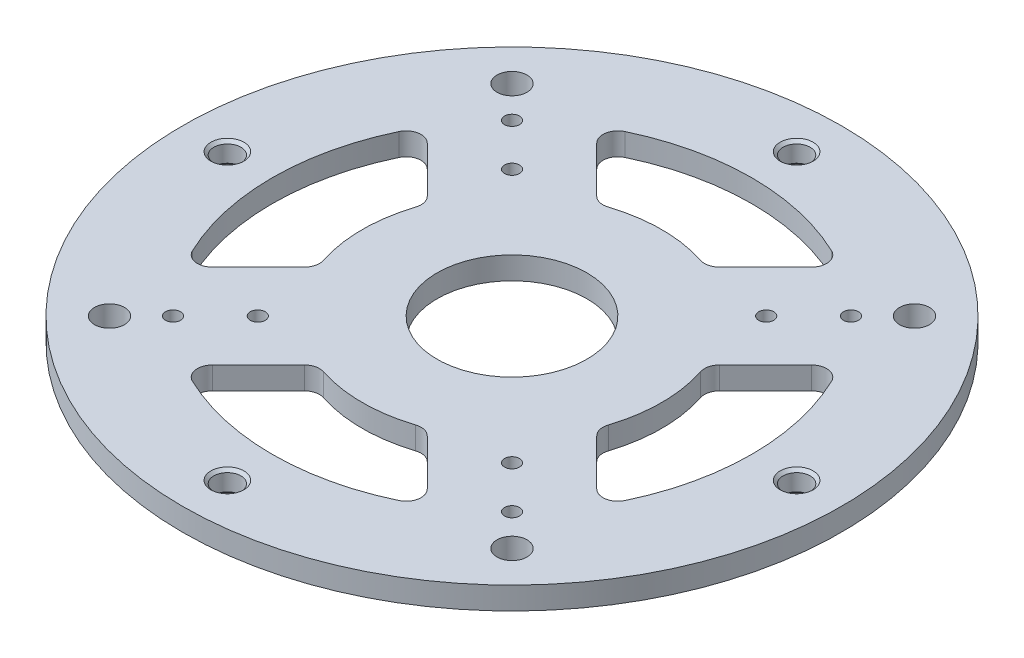
from build123d import *

# Parameters (mm, degrees)
SKETCH2_R                        = 139.7
SKETCH2_R_2                      = 31.75
BOSS_EXTRUDE1_DEPTH              = 9.525
SKETCH3_R                        = 3.175
SKETCH3_R_2                      = 6.35
CUT_EXTRUDE2_DEPTH               = 198.795110215
F_1_2_20_TAPPED_HOLE1_AT_2_COUNT = 2
F_1_2_20_TAPPED_HOLE1_AT_2_PITCH = 170.6248663
F_1_2_20_TAPPED_HOLE1_AT_3_COUNT = 2
F_1_2_20_TAPPED_HOLE1_AT_3_PITCH = 241.3
F_1_2_20_TAPPED_HOLE1_AT_4_COUNT = 2
F_1_2_20_TAPPED_HOLE1_AT_4_PITCH = 170.6248663


with BuildPart() as part:
    # Sketch2 → Boss-Extrude1 (new body)
    with BuildSketch(Plane(origin=(0, 0, 0), x_dir=(1, 0, 0), z_dir=(0, 1, 0))):
        Circle(SKETCH2_R)
        Circle(SKETCH2_R_2, mode=Mode.SUBTRACT)
        with BuildLine():
            Line((61.954602754, 26.03357827), (81.460512242, 45.539487758))
            ThreePointArc((81.460512242, 45.539487758), (87.024437868, 47.307910551), (91.68068299, 43.785983677))
            ThreePointArc((91.68068299, 43.785983677), (101.6, 0), (91.68068299, -43.785983677))
            ThreePointArc((91.68068299, -43.785983677), (87.024437868, -47.307910551), (81.460512242, -45.539487758))
            Line((81.460512242, -45.539487758), (61.954602754, -26.03357827))
            ThreePointArc((61.954602754, -26.03357827), (60.270643836, -23.027751383), (60.404300741, -19.584954736))
            ThreePointArc((60.404300741, -19.584954736), (63.5, 0), (60.404300741, 19.584954736))
            ThreePointArc((60.404300741, 19.584954736), (60.270643836, 23.027751383), (61.954602754, 26.03357827))
        make_face(mode=Mode.SUBTRACT)
        with BuildLine():
            Line((26.03357827, 61.954602754), (45.539487758, 81.460512242))
            ThreePointArc((45.539487758, 81.460512242), (47.307910551, 87.024437868), (43.785983677, 91.68068299))
            ThreePointArc((43.785983677, 91.68068299), (0, 101.6), (-43.785983677, 91.68068299))
            ThreePointArc((-43.785983677, 91.68068299), (-47.307910551, 87.024437868), (-45.539487758, 81.460512242))
            Line((-45.539487758, 81.460512242), (-26.03357827, 61.954602754))
            ThreePointArc((-26.03357827, 61.954602754), (-23.027751383, 60.270643836), (-19.584954736, 60.404300741))
            ThreePointArc((-19.584954736, 60.404300741), (0, 63.5), (19.584954736, 60.404300741))
            ThreePointArc((19.584954736, 60.404300741), (23.027751383, 60.270643836), (26.03357827, 61.954602754))
        make_face(mode=Mode.SUBTRACT)
        with BuildLine():
            Line((26.03357827, -61.954602754), (45.539487758, -81.460512242))
            ThreePointArc((45.539487758, -81.460512242), (47.307910551, -87.024437868), (43.785983677, -91.68068299))
            ThreePointArc((43.785983677, -91.68068299), (0, -101.6), (-43.785983677, -91.68068299))
            ThreePointArc((-43.785983677, -91.68068299), (-47.307910551, -87.024437868), (-45.539487758, -81.460512242))
            Line((-45.539487758, -81.460512242), (-26.03357827, -61.954602754))
            ThreePointArc((-26.03357827, -61.954602754), (-23.027751383, -60.270643836), (-19.584954736, -60.404300741))
            ThreePointArc((-19.584954736, -60.404300741), (0, -63.5), (19.584954736, -60.404300741))
            ThreePointArc((19.584954736, -60.404300741), (23.027751383, -60.270643836), (26.03357827, -61.954602754))
        make_face(mode=Mode.SUBTRACT)
        with BuildLine():
            Line((-61.954602754, -26.03357827), (-81.460512242, -45.539487758))
            ThreePointArc((-81.460512242, -45.539487758), (-87.024437868, -47.307910551), (-91.68068299, -43.785983677))
            ThreePointArc((-91.68068299, -43.785983677), (-101.6, 0), (-91.68068299, 43.785983677))
            ThreePointArc((-91.68068299, 43.785983677), (-87.024437868, 47.307910551), (-81.460512242, 45.539487758))
            Line((-81.460512242, 45.539487758), (-61.954602754, 26.03357827))
            ThreePointArc((-61.954602754, 26.03357827), (-60.270643836, 23.027751383), (-60.404300741, 19.584954736))
            ThreePointArc((-60.404300741, 19.584954736), (-63.5, 0), (-60.404300741, -19.584954736))
            ThreePointArc((-60.404300741, -19.584954736), (-60.270643836, -23.027751383), (-61.954602754, -26.03357827))
        make_face(mode=Mode.SUBTRACT)
    extrude(amount=BOSS_EXTRUDE1_DEPTH)

    # Sketch3 → Cut-Extrude2 (cut, through all)
    with BuildSketch(Plane(origin=(0, 9.525, 0), x_dir=(1, 0, 0), z_dir=(0, 1, 0))):
        with Locations((-71.842048969, 71.842048969)):
            Circle(SKETCH3_R)
        with Locations((-53.881536726, 53.881536726)):
            Circle(SKETCH3_R)
        with Locations((-71.842048969, -71.842048969)):
            Circle(SKETCH3_R)
        with Locations((71.842048969, -71.842048969)):
            Circle(SKETCH3_R)
        with Locations((71.842048969, 71.842048969)):
            Circle(SKETCH3_R)
        with Locations((53.881536726, 53.881536726)):
            Circle(SKETCH3_R)
        with Locations((53.881536726, -53.881536726)):
            Circle(SKETCH3_R)
        with Locations((-53.881536726, -53.881536726)):
            Circle(SKETCH3_R)
        with Locations((85.31243315, 85.31243315)):
            Circle(SKETCH3_R_2)
        with Locations((85.31243315, -85.31243315)):
            Circle(SKETCH3_R_2)
        with Locations((-85.31243315, -85.31243315)):
            Circle(SKETCH3_R_2)
        with Locations((-85.31243315, 85.31243315)):
            Circle(SKETCH3_R_2)
    extrude(amount=-CUT_EXTRUDE2_DEPTH, mode=Mode.SUBTRACT)

    # Sketch7 → 1/2-20 Tapped Hole1 (revolve, cut)
    with BuildSketch(Plane(origin=(-120.65, 9.525, 0), x_dir=(0, 0, 1), z_dir=(1, 0, 0))):
        Polygon((0, 0), (0, 9.525), (6.985, 9.525), (5.75437, 8.29437), (5.75437, 1.23063), (6.985, 0), align=None)
    f_1_2_20_tapped_hole1 = revolve(axis=Axis((-120.65, 15.875, 0), (0, -1, 0)), mode=Mode.SUBTRACT)

    # 1/2-20 Tapped Hole1 at 2: 1/2-20 Tapped Hole1 ×2
    with Locations(*[Vector(0.7071067811865476, 0, -0.7071067811865476) * (i * F_1_2_20_TAPPED_HOLE1_AT_2_PITCH) for i in range(1, F_1_2_20_TAPPED_HOLE1_AT_2_COUNT)]):
        add(f_1_2_20_tapped_hole1, mode=Mode.SUBTRACT)

    # 1/2-20 Tapped Hole1 at 3: 1/2-20 Tapped Hole1 ×2
    with Locations(*[(i * F_1_2_20_TAPPED_HOLE1_AT_3_PITCH, 0, 0) for i in range(1, F_1_2_20_TAPPED_HOLE1_AT_3_COUNT)]):
        add(f_1_2_20_tapped_hole1, mode=Mode.SUBTRACT)

    # 1/2-20 Tapped Hole1 at 4: 1/2-20 Tapped Hole1 ×2
    with Locations(*[Vector(0.7071067811865475, 0, 0.7071067811865477) * (i * F_1_2_20_TAPPED_HOLE1_AT_4_PITCH) for i in range(1, F_1_2_20_TAPPED_HOLE1_AT_4_COUNT)]):
        add(f_1_2_20_tapped_hole1, mode=Mode.SUBTRACT)


solid = part.part
